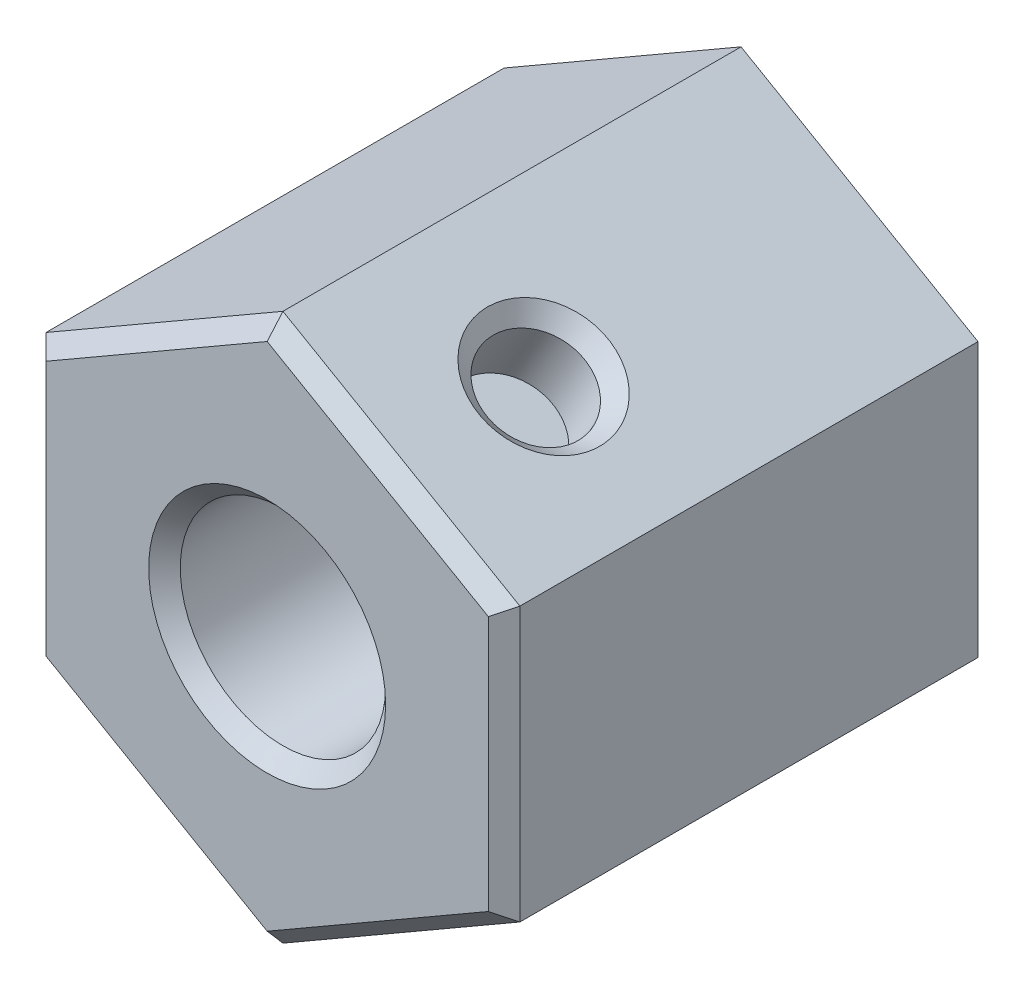
from build123d import *

# Parameters (mm, degrees)
BOSS_EXTRUDE1_DEPTH = 15
SKETCH2_R           = 3.25
CUT_EXTRUDE1_DEPTH  = 15
CUT_EXTRUDE2_DEPTH  = 2.5
SKETCH4_R           = 1.55
CUT_EXTRUDE3_DEPTH  = 2.5
CIRPATTERN1_COUNT   = 3
CHAMFER1_SIZE       = 0.5
CHAMFER2_SIZE       = 0.5
CHAMFER3_SIZE       = 0.5
CHAMFER4_SIZE       = 0.4


with BuildPart() as part:
    # Sketch1 → Boss-Extrude1 (new body)
    with BuildSketch(Plane.XY):
        Polygon((0, 8.660254038), (-7.5, 4.330127019), (-7.5, -4.330127019), (0, -8.660254038), (7.5, -4.330127019), (7.5, 4.330127019), align=None)
    extrude(amount=BOSS_EXTRUDE1_DEPTH)

    # Sketch2 → Cut-Extrude1 (cut)
    with BuildSketch(Plane.XY.offset(15)):
        Circle(SKETCH2_R)
    extrude(amount=-CUT_EXTRUDE1_DEPTH, mode=Mode.SUBTRACT)

    # Sketch3 → Cut-Extrude2 (cut)
    with BuildSketch(Plane(origin=(0, 0, 0), x_dir=(-1, 0, 0), z_dir=(0, 0, -1))):
        Polygon((0, 6.0044428), (-5.2, 3.0022214), (-5.2, -3.0022214), (0, -6.0044428), (5.2, -3.0022214), (5.2, 3.0022214), align=None)
    extrude(amount=-CUT_EXTRUDE2_DEPTH, mode=Mode.SUBTRACT)

    # Sketch4 → Cut-Extrude3 (cut)
    with BuildSketch(Plane(origin=(3.75, 6.495190528, 0), x_dir=(0.8660254037844417, -0.4999999999999949, 0), z_dir=(0.4999999999999949, 0.8660254037844417, 0))):
        with Locations((0, -10)):
            Circle(SKETCH4_R)
    cut_extrude3 = extrude(amount=-CUT_EXTRUDE3_DEPTH, mode=Mode.SUBTRACT)

    # CirPattern1: Cut-Extrude3 ×3 about axis
    cirpattern1_axis = Axis((0, 0, 15), (0, 0, 1))
    for i in range(1, CIRPATTERN1_COUNT):
        add(cut_extrude3.rotate(cirpattern1_axis, i * 360 / CIRPATTERN1_COUNT), mode=Mode.SUBTRACT)

    # Chamfer1
    chamfer1_edges = [part.edges().sort_by_distance(p)[0] for p in [
        (7.5, 0, 15),
        (3.75, -6.495190528, 15),
        (-3.75, -6.495190528, 15),
        (-7.5, 0, 15),
        (-3.75, 6.495190528, 15),
        (3.75, 6.495190528, 15),
        (-3.25, 0, 15),
    ]]
    chamfer(chamfer1_edges, length=CHAMFER1_SIZE)

    # Chamfer2
    chamfer2_edges = [part.edges().sort_by_distance(p)[0] for p in [
        (-7.5, -1.55, 10),
        (5.092339376, -5.720190528, 10),
        (2.407660624, 7.270190528, 10),
    ]]
    chamfer(chamfer2_edges, length=CHAMFER2_SIZE)

    # Chamfer3
    chamfer3_edges = [part.edges().sort_by_distance(p)[0] for p in [
        (-3.25, 0, 2.5),
    ]]
    chamfer(chamfer3_edges, length=CHAMFER3_SIZE)

    # Chamfer4
    chamfer4_edges = [part.edges().sort_by_distance(p)[0] for p in [
        (-2.6, 4.5033321, 0),
        (2.6, 4.5033321, 0),
        (5.2, 0, 0),
        (2.6, -4.5033321, 0),
        (-2.6, -4.5033321, 0),
        (-5.2, 0, 0),
    ]]
    chamfer(chamfer4_edges, length=CHAMFER4_SIZE)


solid = part.part
